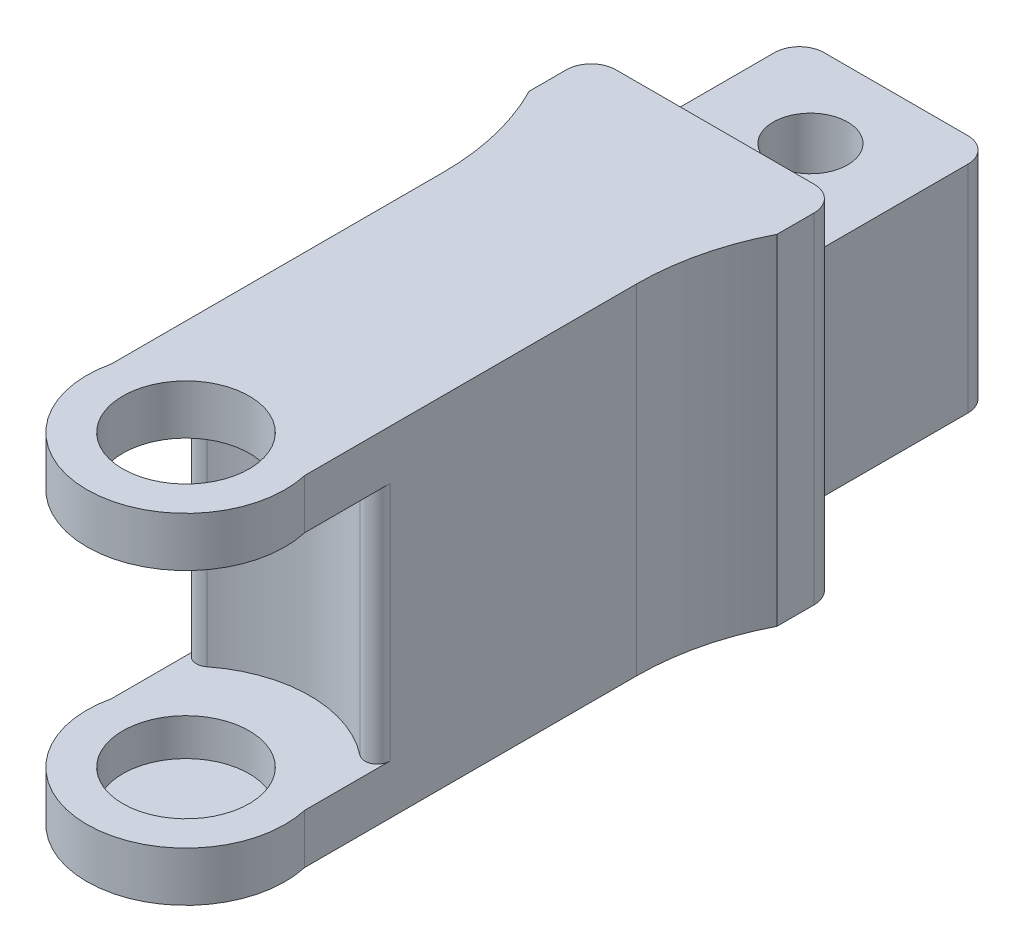
from build123d import *

# Parameters (mm, degrees)
SKETCH2_R           = 1.5
BOSS_EXTRUDE1_DEPTH = 8.7
SKETCH3_R           = 4
SKETCH3_R_2         = 2.55
BOSS_EXTRUDE2_DEPTH = 2.5
BOSS_EXTRUDE3_START = -11.2
SKETCH3_3_R         = 4
SKETCH3_3_R_2       = 2.55
BOSS_EXTRUDE3_DEPTH = 2.5
CUT_EXTRUDE1_START  = -0.5
SKETCH2_3_R         = 5
SKETCH2_3_R_2       = 2.55
CUT_EXTRUDE1_DEPTH  = 9.7
BOSS_EXTRUDE4_START = -2.5
SKETCH2_4_R         = 2.55
BOSS_EXTRUDE4_DEPTH = 0.5
FILLET1_R           = 10
FILLET2_R           = 0.5
FILLET3_R           = 1


with BuildPart() as part:
    # Sketch2 → Boss-Extrude1 (new body)
    with BuildSketch(Plane(origin=(0, 0, 0), x_dir=(1, 0, 0), z_dir=(0, 1, 0))):
        with BuildLine():
            Line((3.9, 3.65), (-3.9, 3.65))
            Line((-3.9, 3.65), (-3.9, -3.65))
            Line((-3.9, -3.65), (-5, -3.65))
            Line((-5, -3.65), (-5, -6.15))
            Line((-5, -6.15), (-3.9, -6.15))
            Line((-3.9, -6.15), (-3.9, -21.871102431))
            ThreePointArc((-3.9, -21.871102431), (0, -20), (3.9, -21.871102431))
            Line((3.9, -21.871102431), (3.9, -6.15))
            Line((3.9, -6.15), (5, -6.15))
            Line((5, -6.15), (5, -3.65))
            Line((5, -3.65), (3.9, -3.65))
            Line((3.9, -3.65), (3.9, 3.65))
        make_face()
        with Locations(Location((0, 0.2, 0), (0, 0, 270))):
            Circle(SKETCH2_R, mode=Mode.SUBTRACT)
    extrude(amount=BOSS_EXTRUDE1_DEPTH)

    # Sketch3 → Boss-Extrude2 (add)
    # profile 1 of 4: a face of its own
    with BuildSketch(Plane(origin=(0, 8.7, 0), x_dir=(1, 0, 0), z_dir=(0, 1, 0))):
        Polygon((-5, -3.65), (-5, -6.15), (-3.9, -6.15), (3.9, -6.15), (5, -6.15), (5, -3.65), (3.9, -3.65), (-3.9, -3.65), align=None)
    # profile 2 of 4: a face of its own
    with BuildSketch(Plane(origin=(0, 8.7, 0), x_dir=(1, 0, 0), z_dir=(0, 1, 0))):
        with BuildLine():
            Line((3.9, -6.15), (-3.9, -6.15))
            Line((-3.9, -6.15), (-3.9, -21.871102431))
            ThreePointArc((-3.9, -21.871102431), (0, -20), (3.9, -21.871102431))
            Line((3.9, -21.871102431), (3.9, -6.15))
        make_face()
    # profile 3 of 4: a face of its own
    with BuildSketch(Plane(origin=(0, 8.7, 0), x_dir=(1, 0, 0), z_dir=(0, 1, 0))):
        with Locations((0, -25)):
            Circle(SKETCH3_R)
        with Locations(Location((0, -25, 0), (0, 0, 270))):
            Circle(SKETCH3_R_2, mode=Mode.SUBTRACT)
    # profile 4 of 4: a face of its own
    with BuildSketch(Plane(origin=(0, 8.7, 0), x_dir=(1, 0, 0), z_dir=(0, 1, 0))):
        with BuildLine():
            ThreePointArc((3.9, -21.871102431), (0, -20), (-3.9, -21.871102431))
            Line((-3.9, -21.871102431), (-3.9, -24.111180558))
            ThreePointArc((-3.9, -24.111180558), (0, -21), (3.9, -24.111180558))
            Line((3.9, -24.111180558), (3.9, -21.871102431))
        make_face()
    extrude(amount=BOSS_EXTRUDE2_DEPTH)

    # Sketch3<3> → Boss-Extrude3 (add)
    # profile 1 of 4: a face of its own
    with BuildSketch(Plane(origin=(0, 8.7, 0), x_dir=(1, 0, 0), z_dir=(0, 1, 0)).offset(BOSS_EXTRUDE3_START)):
        with Locations((0, -25)):
            Circle(SKETCH3_3_R)
        with Locations(Location((0, -25, 0), (0, 0, 270))):
            Circle(SKETCH3_3_R_2, mode=Mode.SUBTRACT)
    # profile 2 of 4: a face of its own
    with BuildSketch(Plane(origin=(0, 8.7, 0), x_dir=(1, 0, 0), z_dir=(0, 1, 0)).offset(BOSS_EXTRUDE3_START)):
        with BuildLine():
            ThreePointArc((3.9, -21.871102431), (0, -20), (-3.9, -21.871102431))
            Line((-3.9, -21.871102431), (-3.9, -24.111180558))
            ThreePointArc((-3.9, -24.111180558), (0, -21), (3.9, -24.111180558))
            Line((3.9, -24.111180558), (3.9, -21.871102431))
        make_face()
    # profile 3 of 4: a face of its own
    with BuildSketch(Plane(origin=(0, 8.7, 0), x_dir=(1, 0, 0), z_dir=(0, 1, 0)).offset(BOSS_EXTRUDE3_START)):
        with BuildLine():
            Line((3.9, -6.15), (-3.9, -6.15))
            Line((-3.9, -6.15), (-3.9, -21.871102431))
            ThreePointArc((-3.9, -21.871102431), (0, -20), (3.9, -21.871102431))
            Line((3.9, -21.871102431), (3.9, -6.15))
        make_face()
    # profile 4 of 4: a face of its own
    with BuildSketch(Plane(origin=(0, 8.7, 0), x_dir=(1, 0, 0), z_dir=(0, 1, 0)).offset(BOSS_EXTRUDE3_START)):
        Polygon((-5, -3.65), (-5, -6.15), (-3.9, -6.15), (3.9, -6.15), (5, -6.15), (5, -3.65), (3.9, -3.65), (-3.9, -3.65), align=None)
    extrude(amount=BOSS_EXTRUDE3_DEPTH)

    # Sketch2<3> → Cut-Extrude1 (cut)
    with BuildSketch(Plane(origin=(0, 0, 0), x_dir=(1, 0, 0), z_dir=(0, 1, 0)).offset(CUT_EXTRUDE1_START)):
        with Locations((0, -25)):
            Circle(SKETCH2_3_R)
        with Locations(Location((0, -25, 0), (0, 0, 270))):
            Circle(SKETCH2_3_R_2, mode=Mode.SUBTRACT)
    extrude(amount=CUT_EXTRUDE1_DEPTH, mode=Mode.SUBTRACT)

    # Sketch2<4> → Boss-Extrude4 (add)
    with BuildSketch(Plane(origin=(0, 0, 0), x_dir=(1, 0, 0), z_dir=(0, 1, 0)).offset(BOSS_EXTRUDE4_START)):
        with Locations(Location((0, -25, 0), (0, 0, 270))):
            Circle(SKETCH2_4_R)
    extrude(amount=BOSS_EXTRUDE4_DEPTH)

    # Fillet1
    # the kernel refuses this fillet: 10 mm, written as the material it adds along each edge
    with BuildSketch(Plane(origin=(-3.9, -2.5, 6.15), x_dir=(-1, 0, 0), z_dir=(0, 1, 0)), Plane(origin=(3.9, 11.2, 6.15), x_dir=(1, 0, 0), z_dir=(0, -1, 0))) as fillet1_piece_1:
        with BuildLine():
            CenterArc((10, 4.559605246), FILLET1_R, 180, 27.126753117)
            Line((0, 4.559605246), (-0.2, 4.559605246))
            Line((-0.2, 4.559605246), (-0.2, 0))
            Line((-0.2, 0), (0, -0.2))
            ThreePointArc((0, -0.2), (0.55, -0.2), (0.922, -0.091192105))
            Line((0.922, -0.091192105), (1.1, 0))
        make_face()
    extrude(amount=13.7)

    # Fillet2
    fillet2_edges = [part.edges().sort_by_distance(p)[0] for p in [
        (3.9, 4.35, 21.871102431),
        (-3.9, 4.35, 21.871102431),
    ]]
    fillet(fillet2_edges, radius=FILLET2_R)

    # Fillet3
    fillet3_edges = [part.edges().sort_by_distance(p)[0] for p in [
        (5, 4.35, 3.65),
        (-5, 4.35, 3.65),
        (-3.9, 4.35, -3.65),
        (3.9, 4.35, -3.65),
    ]]
    fillet(fillet3_edges, radius=FILLET3_R)


solid = part.part
